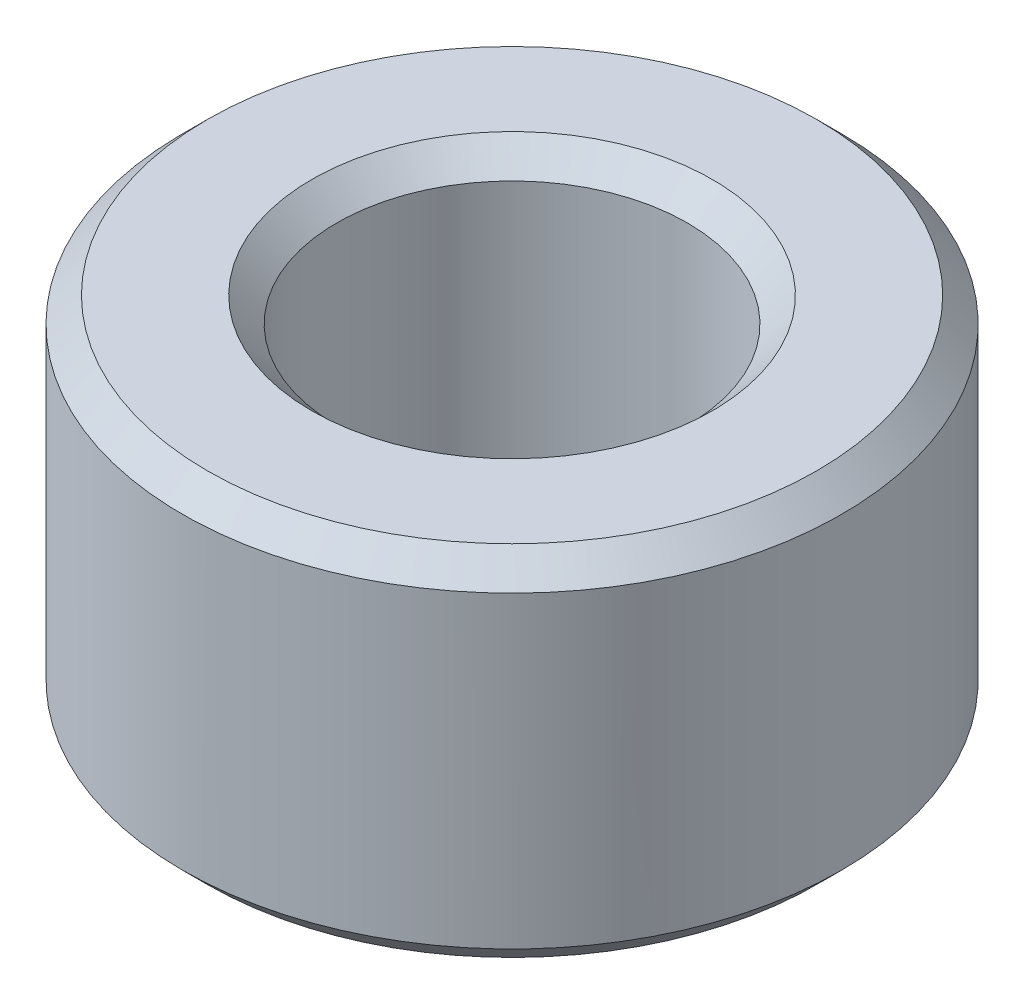
from build123d import *

# Parameters (mm, degrees)
SKETCH1_R           = 40
BOSS_EXTRUDE1_DEPTH = 43.485864408
SKETCH2_R           = 21.277455188
CUT_EXTRUDE1_DEPTH  = 72.351386835
CHAMFER1_SIZE       = 3.042222216


with BuildPart() as part:
    # Sketch1 → Boss-Extrude1 (new body)
    with BuildSketch(Plane(origin=(0, 0, 0), x_dir=(1, 0, 0), z_dir=(0, 1, 0))):
        Circle(SKETCH1_R)
    extrude(amount=BOSS_EXTRUDE1_DEPTH)

    # Sketch2 → Cut-Extrude1 (cut, through all)
    with BuildSketch(Plane(origin=(0, 0, 0), x_dir=(1, 0, 0), z_dir=(0, 1, 0))):
        Circle(SKETCH2_R)
    extrude(amount=CUT_EXTRUDE1_DEPTH, mode=Mode.SUBTRACT)

    # Chamfer1
    chamfer1_edges = [part.edges().sort_by_distance(p)[0] for p in [
        (-21.277455188, 43.485864408, 0),
        (-21.277455188, 0, 0),
        (-40, 0, 0),
        (-40, 43.485864408, 0),
    ]]
    chamfer(chamfer1_edges, length=CHAMFER1_SIZE)


solid = part.part
